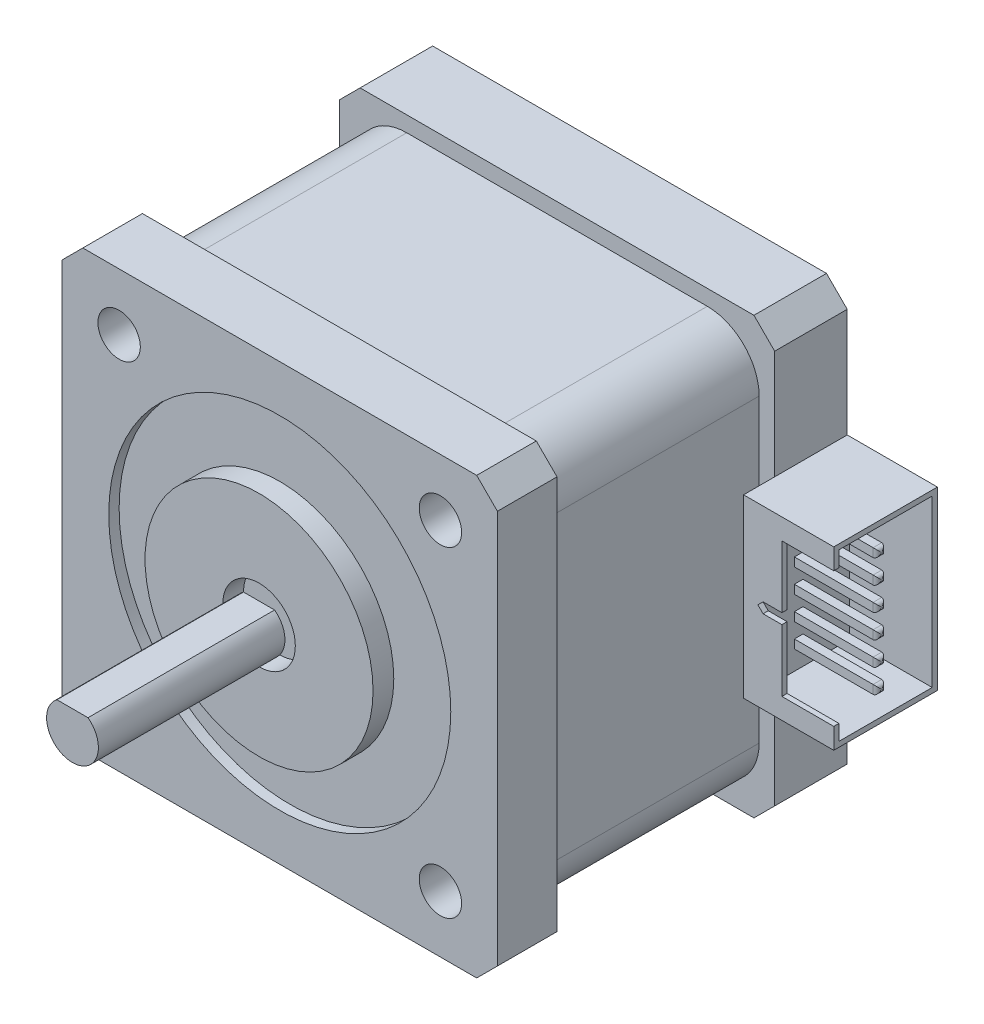
from build123d import *

# Parameters (mm, degrees)
SALIENTE_EXTRUIR1_DEPTH = 53.75
CROQUIS5_W              = 42
CROQUIS5_H              = 42
SALIENTE_EXTRUIR2_DEPTH = 7
CROQUIS5_3_W            = 8.7
CROQUIS5_3_H            = 17
SALIENTE_EXTRUIR3_DEPTH = 10
CROQUIS6_W              = 39
CROQUIS6_H              = 39
SALIENTE_EXTRUIR4_DEPTH = 21
CROQUIS7_W              = 42
CROQUIS7_H              = 42
SALIENTE_EXTRUIR5_DEPTH = 5.75
CROQUIS8_R              = 11
SALIENTE_EXTRUIR6_DEPTH = 2
CROQUIS9_R              = 16.5
CORTAR_EXTRUIR3_DEPTH   = 1
CROQUIS10_R             = 3.5
CORTAR_EXTRUIR4_DEPTH   = 3
CHAFL_N1_SIZE           = 2
REDONDEO1_R             = 5
CROQUIS11_R             = 2.045783435
CORTAR_EXTRUIR5_DEPTH   = 5
CROQUIS12_R             = 2.045783435
CORTAR_EXTRUIR6_DEPTH   = 5
CROQUIS13_W             = 9
CROQUIS13_H             = 16
CORTAR_EXTRUIR7_DEPTH   = 8
CORTAR_EXTRUIR9_DEPTH   = 0.5
CHAFL_N2_SIZE           = 0.5
CROQUIS16_W             = 0.833018764
CROQUIS16_H             = 0.833018765
CROQUIS16_H_2           = 0.833018764
SALIENTE_EXTRUIR7_DEPTH = 8
REDONDEO19_R            = 0.4


with BuildPart() as part:
    # Croquis3 → Saliente-Extruir1 (new body)
    with BuildSketch(Plane.XY):
        with BuildLine():
            Line((-1.5, 2), (1.5, 2))
            ThreePointArc((1.5, 2), (0, -2.5), (-1.5, 2))
        make_face()
    extrude(amount=SALIENTE_EXTRUIR1_DEPTH)

    # Croquis5 → Saliente-Extruir2 (add)
    with BuildSketch(Plane.XY):
        Rectangle(CROQUIS5_W, CROQUIS5_H)
    extrude(amount=SALIENTE_EXTRUIR2_DEPTH)

    # Croquis5<3> → Saliente-Extruir3 (add)
    with BuildSketch(Plane.XY):
        with Locations((25.35, 0)):
            Rectangle(CROQUIS5_3_W, CROQUIS5_3_H)
    extrude(amount=SALIENTE_EXTRUIR3_DEPTH)

    # Croquis6 → Saliente-Extruir4 (add)
    with BuildSketch(Plane.XY.offset(7)):
        Rectangle(CROQUIS6_W, CROQUIS6_H)
    extrude(amount=SALIENTE_EXTRUIR4_DEPTH)

    # Croquis7 → Saliente-Extruir5 (add)
    with BuildSketch(Plane.XY.offset(28)):
        Rectangle(CROQUIS7_W, CROQUIS7_H)
    extrude(amount=SALIENTE_EXTRUIR5_DEPTH)

    # Croquis8 → Saliente-Extruir6 (add)
    with BuildSketch(Plane.XY.offset(33.75)):
        Circle(CROQUIS8_R)
    extrude(amount=SALIENTE_EXTRUIR6_DEPTH)

    # Croquis9 → Cortar-Extruir3 (cut)
    with BuildSketch(Plane.XY.offset(33.75)):
        Circle(CROQUIS9_R)
    extrude(amount=-CORTAR_EXTRUIR3_DEPTH, mode=Mode.SUBTRACT)


with BuildPart() as cortar_extruir3_piece_1:
    # of the separate pieces the step leaves, piece 1, a body of its own (cortar_extruir3_pieces)
    add(part.part.solids().sort_by_distance((21, 21, 0))[0])

    # Chaflán1
    chafl_n1_edges = [cortar_extruir3_piece_1.edges().sort_by_distance(p)[0] for p in [
        (21, -21, 3.5),
        (21, 21, 3.5),
        (-21, 21, 3.5),
        (-21, -21, 3.5),
        (-21, 21, 30.875),
        (-21, -21, 30.875),
        (21, -21, 30.875),
        (21, 21, 30.875),
    ]]
    chamfer(chafl_n1_edges, length=CHAFL_N1_SIZE)

    # Redondeo1
    redondeo1_edges = [cortar_extruir3_piece_1.edges().sort_by_distance(p)[0] for p in [
        (-19.5, 19.5, 17.5),
        (-19.5, -19.5, 17.5),
        (19.5, -19.5, 17.5),
        (19.5, 19.5, 17.5),
    ]]
    fillet(redondeo1_edges, radius=REDONDEO1_R)

    # Croquis11 → Cortar-Extruir5 (cut)
    with BuildSketch(Plane.XY.offset(33.75)):
        with Locations((-15.5, 15.5)):
            Circle(CROQUIS11_R)
        with Locations((15.5, 15.5)):
            Circle(CROQUIS11_R)
        with Locations((15.5, -15.5)):
            Circle(CROQUIS11_R)
        with Locations((-15.5, -15.5)):
            Circle(CROQUIS11_R)
    extrude(amount=-CORTAR_EXTRUIR5_DEPTH, mode=Mode.SUBTRACT)

    # Croquis12 → Cortar-Extruir6 (cut)
    with BuildSketch(Plane.XY):
        with Locations((-15.5, 15.5)):
            Circle(CROQUIS12_R)
        with Locations((15.5, 15.5)):
            Circle(CROQUIS12_R)
        with Locations((15.5, -15.5)):
            Circle(CROQUIS12_R)
        with Locations((-15.5, -15.5)):
            Circle(CROQUIS12_R)
    extrude(amount=CORTAR_EXTRUIR6_DEPTH, mode=Mode.SUBTRACT)

    # Croquis13 → Cortar-Extruir7 (cut)
    with BuildSketch(Plane(origin=(29.7, 0, 0), x_dir=(0, 0, -1), z_dir=(1, 0, 0))):
        with Locations((-5, 0)):
            Rectangle(CROQUIS13_W, CROQUIS13_H)
    extrude(amount=-CORTAR_EXTRUIR7_DEPTH, mode=Mode.SUBTRACT)

    # Croquis15 → Cortar-Extruir9 (cut)
    with BuildSketch(Plane.XY.offset(10)):
        Polygon((29.7, -6.5), (29.7, 6.5), (24.7, 6.5), (24.7, 0.5), (22.381487387, 0.5), (22.381487387, 0), (22.381487387, -0.5), (24.7, -0.5), (24.7, -6.5), align=None)
    extrude(amount=-CORTAR_EXTRUIR9_DEPTH, mode=Mode.SUBTRACT)

    # Chaflán2
    chafl_n2_edges = [cortar_extruir3_piece_1.edges().sort_by_distance(p)[0] for p in [
        (22.381487387, -0.5, 9.75),
        (22.381487387, 0.5, 9.75),
    ]]
    chamfer(chafl_n2_edges, length=CHAFL_N2_SIZE - 0.0001)  # a hair under: the kernel refuses the full size

    # Croquis16 → Saliente-Extruir7 (add)
    with BuildSketch(Plane(origin=(21.7, 0, 0), x_dir=(0, 0, -1), z_dir=(1, 0, 0))):
        with Locations((-5.383746168, 5.714285715)):
            Rectangle(CROQUIS16_W, CROQUIS16_H)
        with Locations((-5.383746168, -5.714285715)):
            Rectangle(CROQUIS16_W, CROQUIS16_H)
        with Locations((-5.383746168, -3.428571429)):
            Rectangle(CROQUIS16_W, CROQUIS16_H)
        with Locations((-5.383746168, -1.142857143)):
            Rectangle(CROQUIS16_W, CROQUIS16_H_2)
        with Locations((-5.383746168, 1.142857143)):
            Rectangle(CROQUIS16_W, CROQUIS16_H_2)
        with Locations((-5.383746168, 3.428571429)):
            Rectangle(CROQUIS16_W, CROQUIS16_H)
    extrude(amount=SALIENTE_EXTRUIR7_DEPTH)

    # Redondeo19
    redondeo19_edges = [cortar_extruir3_piece_1.edges().sort_by_distance(p)[0] for p in [
        (29.7, 5.714285714, 5.80025555),
        (29.7, 5.297776332, 5.383746168),
        (29.7, 5.714285714, 4.967236786),
        (29.7, 6.130795097, 5.383746168),
        (29.7, -5.714285714, 5.80025555),
        (29.7, -6.130795097, 5.383746168),
        (29.7, -5.714285714, 4.967236786),
        (29.7, -5.297776332, 5.383746168),
        (29.7, -3.428571429, 5.80025555),
        (29.7, -3.845080811, 5.383746168),
        (29.7, -3.428571429, 4.967236786),
        (29.7, -3.012062046, 5.383746168),
        (29.7, -1.142857143, 5.80025555),
        (29.7, -1.559366525, 5.383746168),
        (29.7, -1.142857143, 4.967236786),
        (29.7, -0.726347761, 5.383746168),
        (29.7, 1.142857143, 5.80025555),
        (29.7, 0.726347761, 5.383746168),
        (29.7, 1.142857143, 4.967236786),
        (29.7, 1.559366525, 5.383746168),
        (29.7, 3.428571429, 5.80025555),
        (29.7, 3.012062046, 5.383746168),
        (29.7, 3.428571429, 4.967236786),
        (29.7, 3.845080811, 5.383746168),
    ]]
    fillet(redondeo19_edges, radius=REDONDEO19_R)


with BuildPart() as cortar_extruir3_piece_2:
    # of the separate pieces the step leaves, piece 2, a body of its own (cortar_extruir3_pieces)
    add(part.part.solids().sort_by_distance((11, 0, 33.75))[0])

    # Croquis10 → Cortar-Extruir4 (cut)
    with BuildSketch(Plane.XY.offset(35.75)):
        Circle(CROQUIS10_R)
    extrude(amount=-CORTAR_EXTRUIR4_DEPTH, mode=Mode.SUBTRACT)


with BuildPart() as cortar_extruir4_piece_1:
    # of the separate pieces the step leaves, piece 1, a body of its own (cortar_extruir4_pieces)
    add(cortar_extruir3_piece_2.part.solids().sort_by_distance((11, 0, 33.75))[0])


with BuildPart() as cortar_extruir4_piece_2:
    # of the separate pieces the step leaves, piece 2, a body of its own (cortar_extruir4_pieces)
    add(cortar_extruir3_piece_2.part.solids().sort_by_distance((1.5, 2, 35.75))[0])


solid = Compound([cortar_extruir3_piece_1.part, cortar_extruir4_piece_1.part, cortar_extruir4_piece_2.part])
